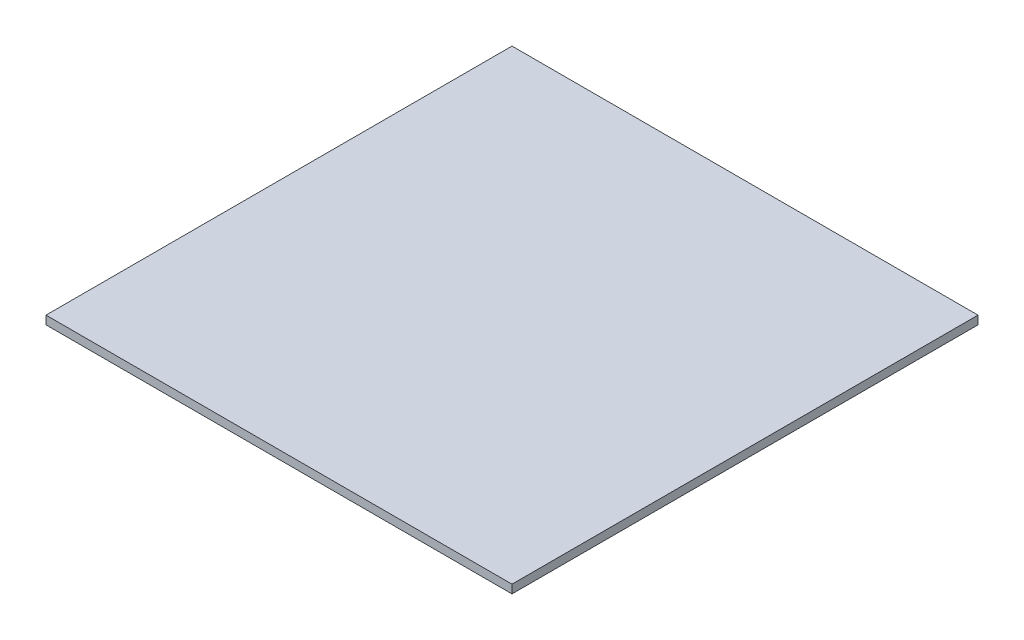
from build123d import *

# Parameters (mm, degrees)
SKETCH1_W      = 88.129615818
SKETCH1_H      = 88.129615818
EXTRUDE1_DEPTH = 1.6002


with BuildPart() as part:
    # Sketch1 → Extrude1 (new body)
    with BuildSketch(Plane(origin=(0, 0, 0), x_dir=(1, 0, 0), z_dir=(0, 1, 0))):
        Rectangle(SKETCH1_W, SKETCH1_H)
    extrude(amount=EXTRUDE1_DEPTH)


solid = part.part
